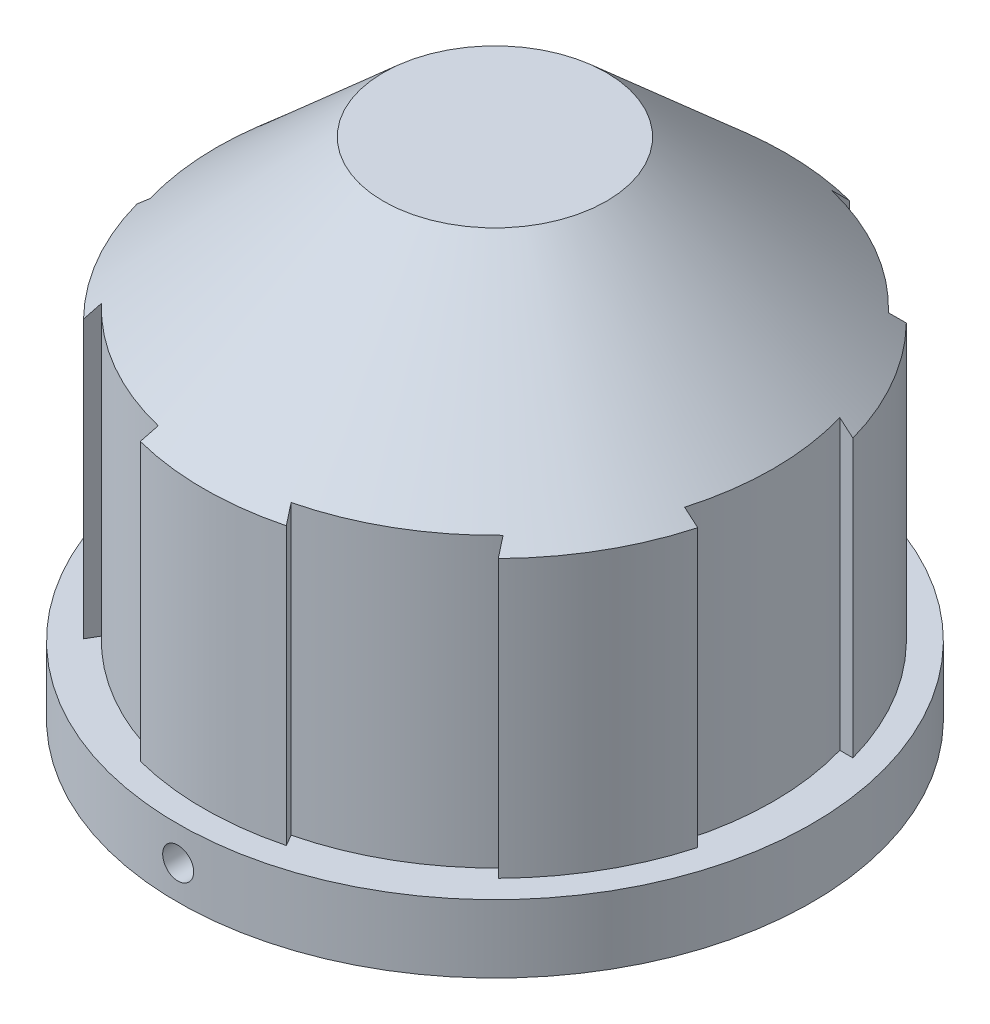
from build123d import *

# Parameters (mm, degrees)
CUT_EXTRUDE1_DEPTH        = 22.5
CIRPATTERN1_COUNT         = 6
M2X0_4_TAPPED_HOLE1_D     = 1.6
M2X0_4_TAPPED_HOLE1_DEPTH = 7
M2X0_4_TAPPED_HOLE1_TIP   = 0.480688495
M2X0_4_TAPPED_HOLE2_D     = 1.6
M2X0_4_TAPPED_HOLE2_DEPTH = 8.2
M2X0_4_TAPPED_HOLE2_TIP   = 0.480688495
THREAD1_PITCH             = 2


with BuildPart() as part:
    # Sketch1 → Revolve3 (revolve)
    with BuildSketch(Plane.XY, mode=Mode.PRIVATE) as revolve3_sk:
        Polygon((12.75, 0), (16.35, 0), (16.35, 3.5), (15, 3.5), (15, 17.778485378), (5.75, 26), (0, 26), (0, 24.5), (3.084626234, 24.5), (3.425, 5), (4.5, 5), (5.696502575, 23.37174091), (12.75, 17.102504994), align=None)
    revolve(revolve3_sk.sketch.rotate(Axis((0, 0, 0), (0, 1, 0)), 90), axis=Axis((0, 0, 0), (0, 1, 0)))

    # Sketch2 → Cut-Extrude1 (cut)
    with BuildSketch(Plane(origin=(0, 26, 0), x_dir=(1, 0, 0), z_dir=(0, 1, 0))):
        with BuildLine():
            Line((13.781237245, -4), (14.456832295, -4))
            ThreePointArc((14.456832295, -4), (15, 0), (14.456832295, 4))
            Line((14.456832295, 4), (13.781237245, 4))
            ThreePointArc((13.781237245, 4), (14.35, 0), (13.781237245, -4))
        make_face()
    cut_extrude1 = extrude(amount=-CUT_EXTRUDE1_DEPTH, mode=Mode.SUBTRACT)

    # CirPattern1: Cut-Extrude1 ×6 about axis
    cirpattern1_axis = Axis((0, 0, 0), (0, 1, 0))
    for i in range(1, CIRPATTERN1_COUNT):
        add(cut_extrude1.rotate(cirpattern1_axis, i * 360 / CIRPATTERN1_COUNT), mode=Mode.SUBTRACT)

    # M2x0.4 Tapped Hole1
    with Locations(Plane.XY.offset(16.35)):
        with Locations((0, 1.75)):
            Hole(M2X0_4_TAPPED_HOLE1_D / 2, depth=M2X0_4_TAPPED_HOLE1_DEPTH)
            with Locations((0, 0, -(M2X0_4_TAPPED_HOLE1_DEPTH + M2X0_4_TAPPED_HOLE1_TIP / 2))):  # 118° drill point
                Cone(0, M2X0_4_TAPPED_HOLE1_D / 2, M2X0_4_TAPPED_HOLE1_TIP, mode=Mode.SUBTRACT)

    # M2x0.4 Tapped Hole2
    with Locations(Plane(origin=(0, 0, -16.35), x_dir=(-1, 0, 0), z_dir=(0, 0, -1))):
        with Locations((0, 1.75)):
            Hole(M2X0_4_TAPPED_HOLE2_D / 2, depth=M2X0_4_TAPPED_HOLE2_DEPTH)
            with Locations((0, 0, -(M2X0_4_TAPPED_HOLE2_DEPTH + M2X0_4_TAPPED_HOLE2_TIP / 2))):  # 118° drill point
                Cone(0, M2X0_4_TAPPED_HOLE2_D / 2, M2X0_4_TAPPED_HOLE2_TIP, mode=Mode.SUBTRACT)

    # Thread1: the profile of Thread Profile1 profile screwed along a right-hand helix of 9 turns, 10 arcs to a turn; built about Z, then put on its axis
    thread1_z = Axis((0, 0, 0), (0, 0, 1))
    thread1_corners = [(12.7497, 0, -0.000173205), (13.83253175, 0, 0.624999997), (13.83253175, 0, 0.874999997), (12.7497, 0, 1.5001732)]
    with BuildLine(mode=Mode.PRIVATE) as thread1_profile:
        Line(thread1_corners[0], thread1_corners[1])
        Line(thread1_corners[1], thread1_corners[2])
        Line(thread1_corners[2], thread1_corners[3])
        Line(thread1_corners[3], thread1_corners[0])
    thread1_cap = Face(thread1_profile.wire())
    thread1_turn_angles = [0, 18, 36, 54, 72, 90, 108, 126, 144, 162, 180, 198, 216, 234, 252, 270, 288, 306, 324, 342, 360]
    thread1_turn_weights = [1, 0.9510565162951535, 1, 0.9510565162951535, 1, 0.9510565162951535, 1, 0.9510565162951535, 1, 0.9510565162951535, 1, 0.9510565162951535, 1, 0.9510565162951535, 1, 0.9510565162951535, 1, 0.9510565162951535, 1, 0.9510565162951535, 1]
    thread1_turn_rails = [Edge.make_bspline([Vector(p[0], p[1], 0).rotate(thread1_z, thread1_turn_angles[k]) / thread1_turn_weights[k] + Vector(0, 0, p[2] + THREAD1_PITCH * thread1_turn_angles[k] / 360) for k in range(21)], [0, 0, 0, 1, 1, 2, 2, 3, 3, 4, 4, 5, 5, 6, 6, 7, 7, 8, 8, 9, 9, 10, 10, 10], 2, thread1_turn_weights) for p in thread1_corners]
    thread1_turn_sides = [Face.make_surface_from_curves(thread1_turn_rails[p[0]], thread1_turn_rails[p[1]]) for p in [(0, 1), (1, 2), (2, 3), (3, 0)]]
    thread1 = Plane(origin=(0, -3, 0), x_dir=(1, 0, 0), z_dir=(0, 1, 0)) * Solid(Shell([*[p.moved(Location((0, 0, THREAD1_PITCH * i))) for i in range(9) for p in thread1_turn_sides], thread1_cap, thread1_cap.rotate(thread1_z, 3240).moved(Location((0, 0, THREAD1_PITCH * 3240 / 360)))]))
    add(thread1, mode=Mode.SUBTRACT)


solid = part.part
